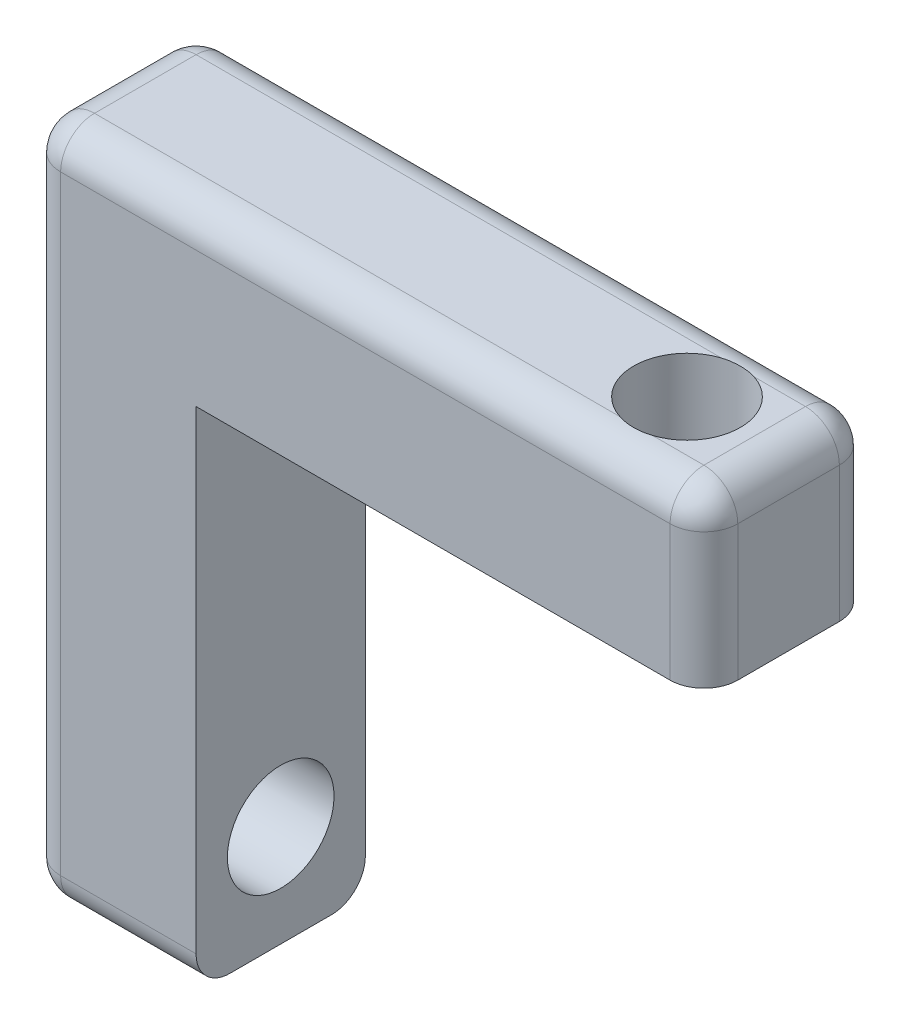
from build123d import *

# Parameters (mm, degrees)
BOSS_EXTRUDE1_DEPTH = 6.35
SKETCH2_R           = 2
CUT_EXTRUDE1_DEPTH  = 37.477972806
SKETCH3_R           = 2
CUT_EXTRUDE2_DEPTH  = 37.477972806
FILLET1_R           = 1.27


with BuildPart() as part:
    # Sketch1 → Boss-Extrude1 (new body)
    with BuildSketch(Plane.XY):
        Polygon((0, 0), (6.35, 0), (6.35, 19.05), (25.4, 19.05), (25.4, 25.4), (0, 25.4), align=None)
    extrude(amount=BOSS_EXTRUDE1_DEPTH)

    # Sketch2 → Cut-Extrude1 (cut, through all)
    with BuildSketch(Plane(origin=(0, 25.4, 0), x_dir=(1, 0, 0), z_dir=(0, 1, 0))):
        with Locations(Location((21.59, -3.175, 0), (0, 0, 270))):
            Circle(SKETCH2_R)
    extrude(amount=-CUT_EXTRUDE1_DEPTH, mode=Mode.SUBTRACT)

    # Sketch3 → Cut-Extrude2 (cut, through all)
    with BuildSketch(Plane.ZY):
        with Locations((3.175, 3.81)):
            Circle(SKETCH3_R)
    extrude(amount=-CUT_EXTRUDE2_DEPTH, mode=Mode.SUBTRACT)

    # Fillet1
    # the kernel refuses this fillet: 1.27 mm, written as the material it takes off along each edge
    with BuildSketch(Plane(origin=(1.27, 24.13, 1.27), x_dir=(0, 0, -1), z_dir=(-1, 0, 0))) as fillet1_piece_1_section:
        Polygon((0, 0), (FILLET1_R, 0), (FILLET1_R, -FILLET1_R), (0, -FILLET1_R), align=None)
    fillet1_piece_1 = extrude(amount=FILLET1_R, mode=Mode.PRIVATE)
    fillet1_piece_1 = fillet1_piece_1 - Plane(origin=(1.27, 24.13, 1.27), x_dir=(0, -0.7071067811865475, 0.7071067811865475), z_dir=(-1, 0, 0)) * Sphere(FILLET1_R, mode=Mode.PRIVATE)
    add(fillet1_piece_1, mode=Mode.SUBTRACT)
    with BuildSketch(Plane(origin=(1.27, 24.13, 5.08), x_dir=(0, 0, 1), z_dir=(-1, 0, 0))) as fillet1_piece_2_section:
        Polygon((0, 0), (FILLET1_R, 0), (FILLET1_R, FILLET1_R), (0, FILLET1_R), align=None)
    fillet1_piece_2 = extrude(amount=FILLET1_R, mode=Mode.PRIVATE)
    fillet1_piece_2 = fillet1_piece_2 - Plane(origin=(1.27, 24.13, 5.08), x_dir=(0, -0.7071067811865475, -0.7071067811865475), z_dir=(-1, 0, 0)) * Sphere(FILLET1_R, mode=Mode.PRIVATE)
    add(fillet1_piece_2, mode=Mode.SUBTRACT)
    with BuildSketch(Plane(origin=(24.13, 24.13, 1.27), x_dir=(0, 0, -1), z_dir=(1, 0, 0))) as fillet1_piece_3_section:
        Polygon((0, 0), (FILLET1_R, 0), (FILLET1_R, FILLET1_R), (0, FILLET1_R), align=None)
    fillet1_piece_3 = extrude(amount=FILLET1_R, mode=Mode.PRIVATE)
    fillet1_piece_3 = fillet1_piece_3 - Plane(origin=(24.13, 24.13, 1.27), x_dir=(0, -0.7071067811865475, 0.7071067811865475), z_dir=(1, 0, 0)) * Sphere(FILLET1_R, mode=Mode.PRIVATE)
    add(fillet1_piece_3, mode=Mode.SUBTRACT)
    with BuildSketch(Plane(origin=(24.13, 24.13, 5.08), x_dir=(0, 0, 1), z_dir=(1, 0, 0))) as fillet1_piece_4_section:
        Polygon((0, 0), (FILLET1_R, 0), (FILLET1_R, -FILLET1_R), (0, -FILLET1_R), align=None)
    fillet1_piece_4 = extrude(amount=FILLET1_R, mode=Mode.PRIVATE)
    fillet1_piece_4 = fillet1_piece_4 - Plane(origin=(24.13, 24.13, 5.08), x_dir=(0, -0.7071067811865475, -0.7071067811865475), z_dir=(1, 0, 0)) * Sphere(FILLET1_R, mode=Mode.PRIVATE)
    add(fillet1_piece_4, mode=Mode.SUBTRACT)
    with BuildSketch(Plane(origin=(1.27, 1.27, 1.27), x_dir=(-1, 0, 0), z_dir=(0, -1, 0))) as fillet1_piece_5_section:
        Polygon((0, 0), (FILLET1_R, 0), (FILLET1_R, FILLET1_R), (0, FILLET1_R), align=None)
    fillet1_piece_5 = extrude(amount=FILLET1_R, mode=Mode.PRIVATE)
    fillet1_piece_5 = fillet1_piece_5 - Plane(origin=(1.27, 1.27, 1.27), x_dir=(0.7071067811865475, 0, 0.7071067811865475), z_dir=(0, -1, 0)) * Sphere(FILLET1_R, mode=Mode.PRIVATE)
    add(fillet1_piece_5, mode=Mode.SUBTRACT)
    with BuildSketch(Plane(origin=(1.27, 1.27, 5.08), x_dir=(-1, 0, 0), z_dir=(0, -1, 0))) as fillet1_piece_6_section:
        Polygon((0, 0), (FILLET1_R, 0), (FILLET1_R, -FILLET1_R), (0, -FILLET1_R), align=None)
    fillet1_piece_6 = extrude(amount=FILLET1_R, mode=Mode.PRIVATE)
    fillet1_piece_6 = fillet1_piece_6 - Plane(origin=(1.27, 1.27, 5.08), x_dir=(0.7071067811865475, 0, -0.7071067811865475), z_dir=(0, -1, 0)) * Sphere(FILLET1_R, mode=Mode.PRIVATE)
    add(fillet1_piece_6, mode=Mode.SUBTRACT)
    with BuildSketch(Plane(origin=(0, 25.4, 1.27), x_dir=(0, -1, 0), z_dir=(0, 0, 1)), Plane(origin=(25.4, 25.4, 1.27), x_dir=(-1, 0, 0), z_dir=(0, 0, 1)), Plane(origin=(0, 0, 1.27), x_dir=(1, 0, 0), z_dir=(0, 0, 1))) as fillet1_piece_7:
        with BuildLine():
            CenterArc((FILLET1_R, FILLET1_R), FILLET1_R, 180, 90)
            Line((0, FILLET1_R), (0, 0))
            Line((0, 0), (FILLET1_R, 0))
        make_face()
    extrude(amount=3.81, mode=Mode.SUBTRACT)
    with BuildSketch(Plane(origin=(25.4, 15.875, 6.35), x_dir=(-1, 0, 0), z_dir=(0, 1, 0)), Plane(origin=(1.27, 0, 0), x_dir=(0, 0, 1), z_dir=(1, 0, 0))) as fillet1_piece_8:
        with BuildLine():
            CenterArc((FILLET1_R, -FILLET1_R), FILLET1_R, 90, 90)
            Line((0, -FILLET1_R), (0, 0))
            Line((0, 0), (FILLET1_R, 0))
        make_face()
    extrude(amount=8.255, mode=Mode.SUBTRACT)
    with BuildSketch(Plane(origin=(24.13, 25.4, 6.35), x_dir=(0, -1, 0), z_dir=(-1, 0, 0)), Plane(origin=(0, 24.13, 0), x_dir=(0, 0, 1), z_dir=(0, -1, 0))) as fillet1_piece_9:
        with BuildLine():
            CenterArc((FILLET1_R, -FILLET1_R), FILLET1_R, 90, 90)
            Line((0, -FILLET1_R), (0, 0))
            Line((0, 0), (FILLET1_R, 0))
        make_face()
    extrude(amount=22.86, mode=Mode.SUBTRACT)
    with BuildSketch(Plane(origin=(0, 24.13, 6.35), x_dir=(0, 0, -1), z_dir=(0, -1, 0)), Plane(origin=(24.13, 25.4, 0), x_dir=(0, -1, 0), z_dir=(-1, 0, 0))) as fillet1_piece_10:
        with BuildLine():
            CenterArc((FILLET1_R, FILLET1_R), FILLET1_R, 180, 90)
            Line((0, FILLET1_R), (0, 0))
            Line((0, 0), (FILLET1_R, 0))
        make_face()
    extrude(amount=22.86, mode=Mode.SUBTRACT)
    with BuildSketch(Plane(origin=(25.4, 15.875, 0), x_dir=(-1, 0, 0), z_dir=(0, 1, 0)), Plane(origin=(1.27, 0, 6.35), x_dir=(0, 0, -1), z_dir=(1, 0, 0))) as fillet1_piece_11:
        with BuildLine():
            CenterArc((FILLET1_R, FILLET1_R), FILLET1_R, 180, 90)
            Line((0, FILLET1_R), (0, 0))
            Line((0, 0), (FILLET1_R, 0))
        make_face()
    extrude(amount=8.255, mode=Mode.SUBTRACT)


solid = part.part
